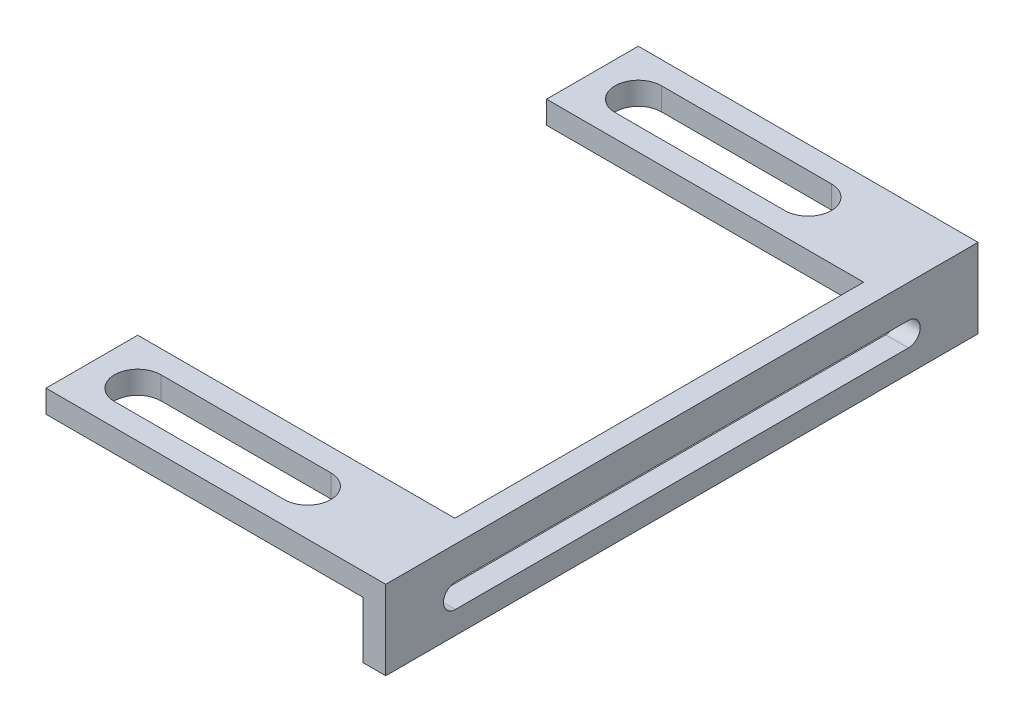
from build123d import *

# Parameters (mm, degrees)
SKETCH1_W           = 28
SKETCH1_H           = 26.15
BOSS_EXTRUDE1_DEPTH = 2
SKETCH12_W          = 52.3
SKETCH12_H          = 7
BOSS_EXTRUDE2_DEPTH = 2
SKETCH13_W          = 30
SKETCH13_H          = 36.1
CUT_EXTRUDE3_DEPTH  = 2
SKETCH15_W          = 2
SKETCH15_H          = 36.1
BOSS_EXTRUDE3_DEPTH = 2


with BuildPart() as part:
    # Sketch1 → Boss-Extrude1 (new body)
    # profile 1 of 2: a face of its own
    with BuildSketch(Plane(origin=(0, 0, 0), x_dir=(1, 0, 0), z_dir=(0, 1, 0))):
        with Locations((14, 39.225)):
            Rectangle(SKETCH1_W, SKETCH1_H)
        with BuildLine():
            Line((19.05, 46.2), (4.05, 46.2))
            ThreePointArc((4.05, 46.2), (2, 48.25), (4.05, 50.3))
            Line((4.05, 50.3), (19.05, 50.3))
            ThreePointArc((19.05, 50.3), (21.1, 48.25), (19.05, 46.2))
        make_face(mode=Mode.SUBTRACT)
    # profile 2 of 2: a face of its own
    with BuildSketch(Plane(origin=(0, 0, 0), x_dir=(1, 0, 0), z_dir=(0, 1, 0))):
        with Locations((14, 13.075)):
            Rectangle(SKETCH1_W, SKETCH1_H)
        with BuildLine():
            ThreePointArc((4.05, 2), (2, 4.05), (4.05, 6.1))
            Line((4.05, 6.1), (19.05, 6.1))
            ThreePointArc((19.05, 6.1), (21.1, 4.05), (19.05, 2))
            Line((19.05, 2), (4.05, 2))
        make_face(mode=Mode.SUBTRACT)
    extrude(amount=BOSS_EXTRUDE1_DEPTH)

    # Sketch12 → Boss-Extrude2 (add)
    with BuildSketch(Plane(origin=(28, 0, 0), x_dir=(0, 0, -1), z_dir=(1, 0, 0))):
        with Locations((26.15, -1.5)):
            Rectangle(SKETCH12_W, SKETCH12_H)
        with BuildLine():
            Line((6.15, -0.9), (46.15, -0.9))
            ThreePointArc((46.15, -0.9), (47.2, -1.95), (46.15, -3))
            Line((46.15, -3), (6.15, -3))
            ThreePointArc((6.15, -3), (5.1, -1.95), (6.15, -0.9))
        make_face(mode=Mode.SUBTRACT)
    extrude(amount=BOSS_EXTRUDE2_DEPTH)

    # Sketch13 → Cut-Extrude3 (cut)
    with BuildSketch(Plane(origin=(0, 2, 0), x_dir=(1, 0, 0), z_dir=(0, 1, 0))):
        with Locations((15, 26.15)):
            Rectangle(SKETCH13_W, SKETCH13_H)
    extrude(amount=-CUT_EXTRUDE3_DEPTH, mode=Mode.SUBTRACT)

    # Sketch15 → Boss-Extrude3 (add)
    with BuildSketch(Plane(origin=(0, 0, 0), x_dir=(1, 0, 0), z_dir=(0, 1, 0))):
        with Locations((29, 26.15)):
            Rectangle(SKETCH15_W, SKETCH15_H)
    extrude(amount=BOSS_EXTRUDE3_DEPTH)


solid = part.part
